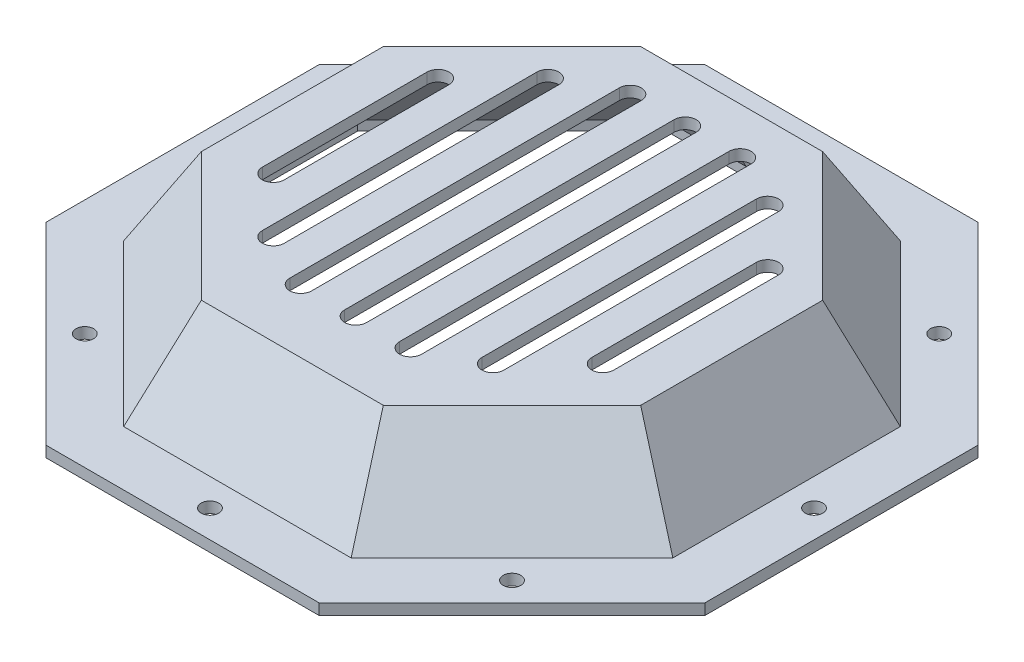
from build123d import *

# Parameters (mm, degrees)
SKETCH1_R           = 1.6
BOSS_EXTRUDE1_DEPTH = 3
CUT_EXTRUDE1_DEPTH  = 85.905830189
BOSS_EXTRUDE2_DEPTH = 2
BOSS_EXTRUDE3_DEPTH = 3
SHELL1_DEPTH        = 15
SHELL1_DRAFT        = 30.4655449
SKETCH6_W           = 10
SKETCH6_H           = 10
CUT_EXTRUDE2_DEPTH  = 88.177978871
CUT_EXTRUDE3_DEPTH  = 88.177978894
SKETCH8_W           = 151.222151061
SKETCH8_H           = 131.165318394
CUT_EXTRUDE4_DEPTH  = 1


# Read off the part's stored shape, not the designer's step: Shell1
with BuildPart() as part:
    # Sketch1 → Boss-Extrude1 (new body)
    with BuildSketch(Plane(origin=(0, 0, 0), x_dir=(1, 0, 0), z_dir=(0, 1, 0))):
        Polygon((24.852813742, 60), (-24.852813742, 60), (-60, 24.852813742), (-60, -24.852813742), (-24.852813742, -60), (24.852813742, -60), (60, -24.852813742), (60, 24.852813742), align=None)
        with Locations(Location((-38.890872965, -38.890872965, 0), (0, 0, 270))):
            Circle(SKETCH1_R, mode=Mode.SUBTRACT)
        with Locations(Location((0, -55, 0), (0, 0, 270))):
            Circle(SKETCH1_R, mode=Mode.SUBTRACT)
        with Locations(Location((38.890872965, -38.890872965, 0), (0, 0, 270))):
            Circle(SKETCH1_R, mode=Mode.SUBTRACT)
        with Locations(Location((38.890872965, 38.890872965, 0), (0, 0, 270))):
            Circle(SKETCH1_R, mode=Mode.SUBTRACT)
        with Locations(Location((0, 55, 0), (0, 0, 270))):
            Circle(SKETCH1_R, mode=Mode.SUBTRACT)
        with Locations(Location((-38.890872965, 38.890872965, 0), (0, 0, 270))):
            Circle(SKETCH1_R, mode=Mode.SUBTRACT)
        with Locations(Location((55, 0, 0), (0, 0, 270))):
            Circle(SKETCH1_R, mode=Mode.SUBTRACT)
        with Locations(Location((-55, 0, 0), (0, 0, 270))):
            Circle(SKETCH1_R, mode=Mode.SUBTRACT)
    extrude(amount=BOSS_EXTRUDE1_DEPTH)

    # Sketch2 → Cut-Extrude1 (cut, through all)
    with BuildSketch(Plane(origin=(0, 3, 0), x_dir=(1, 0, 0), z_dir=(0, 1, 0))):
        Polygon((20.710678119, 50), (-20.710678119, 50), (-50, 20.710678119), (-50, -20.710678119), (-20.710678119, -50), (20.710678119, -50), (50, -20.710678119), (50, 20.710678119), align=None)
    extrude(amount=-CUT_EXTRUDE1_DEPTH, mode=Mode.SUBTRACT)



with BuildPart() as body_2:
    # Sketch3 → Boss-Extrude2 (new body)
    with BuildSketch(Plane(origin=(0, 18, 0), x_dir=(1, 0, 0), z_dir=(0, 1, 0))):
        Polygon((16.568542495, 40), (-16.568542495, 40), (-40, 16.568542495), (-40, -16.568542495), (-16.568542495, -40), (16.568542495, -40), (40, -16.568542495), (40, 16.568542495), align=None)
    extrude(amount=BOSS_EXTRUDE2_DEPTH)

    # Sketch2<2> → section 0 of loft1
    with BuildSketch(Plane(origin=(0, 3, 0), x_dir=(1, 0, 0), z_dir=(0, 1, 0)), mode=Mode.PRIVATE) as loft1_s0:
        with BuildLine():
            Line((20.710678119, 50), (-20.710678119, 50))
            Line((-20.710678119, 50), (-50, 20.710678119))
            Line((-50, 20.710678119), (-50, -20.710678119))
            Line((-50, -20.710678119), (-20.710678119, -50))
            Line((-20.710678119, -50), (20.710678119, -50))
            Line((20.710678119, -50), (50, -20.710678119))
            Line((50, -20.710678119), (50, 20.710678119))
            Line((50, 20.710678119), (20.710678119, 50))
        make_face()
    # loft up to a face of the part (loft1)
    loft([loft1_s0.sketch, body_2.faces().sort_by_distance((0, 20, 0))[0]])


with BuildPart() as part_1:
    add(part.part)

    add(body_2.part)  # Boss-Extrude3 merges body 2
    # Sketch5 → Boss-Extrude3 (add)
    with BuildSketch(Plane.XZ.offset(-3)):
        Polygon((-50, -20.710678119), (-20.710678119, -50), (20.710678119, -50), (50, -20.710678119), (50, 20.710678119), (20.710678119, 50), (-20.710678119, 50), (-50, 20.710678119), align=None)
        Polygon((48, -19.882250994), (19.882250994, -48), (-19.882250994, -48), (-48, -19.882250994), (-48, 19.882250994), (-19.882250994, 48), (19.882250994, 48), (48, 19.882250994), align=None, mode=Mode.SUBTRACT)
    extrude(amount=BOSS_EXTRUDE3_DEPTH)


with BuildPart() as shell1_tool:
    # Shell1 outline → Shell1 (with draft: the straight prism first)
    with BuildSketch(Plane(origin=(0, 18, 0), x_dir=(1, 0, 0), z_dir=(0, 1, 0))):
        Polygon((16.09472687, 38.856107891), (-16.09472687, 38.856107891), (-38.856107891, 16.09472687), (-38.856107891, -16.09472687), (-16.09472687, -38.856107891), (16.09472687, -38.856107891), (38.856107891, -16.09472687), (38.856107891, 16.09472687), align=None)
    extrude(amount=-SHELL1_DEPTH)
    # Shell1: the draft: its side faces are tilted about the plane it starts from
    shell1_sides = [shell1_tool.faces().sort_by_distance(p)[0] for p in [
        (0, 10.5, -38.856107891),
        (-27.475417381, 10.5, -27.47541738),
        (-38.856107891, 10.5, 0),
        (-27.47541738, 10.5, 27.475417381),
        (0, 10.5, 38.856107891),
        (27.475417381, 10.5, 27.47541738),
        (38.856107891, 10.5, 0),
        (27.47541738, 10.5, -27.475417381),
    ]]
    draft(shell1_sides, Plane(origin=(0, 18, 0), x_dir=(1, 0, 0), z_dir=(0, 1, 0)), SHELL1_DRAFT)


with BuildPart() as part_2:
    add(part_1.part)

    # Shell1: cut by shell1_tool
    add(shell1_tool.part, mode=Mode.SUBTRACT)

    # Sketch6 → Cut-Extrude2 (cut, through all)
    with BuildSketch(Plane(origin=(0, 20, 0), x_dir=(1, 0, 0), z_dir=(0, 1, 0))):
        with Locations((0, 45)):
            Rectangle(SKETCH6_W, SKETCH6_H)
    extrude(amount=-CUT_EXTRUDE2_DEPTH, mode=Mode.SUBTRACT)

    # Sketch7 → Cut-Extrude3 (cut, through all)
    with BuildSketch(Plane(origin=(0, 20, 0), x_dir=(1, 0, 0), z_dir=(0, 1, 0))):
        with BuildLine():
            Line((-22, 26.533930893), (-22, -23.466069107))
            ThreePointArc((-22, -23.466069107), (-20, -25.466069107), (-18, -23.466069107))
            Line((-18, -23.466069107), (-18, 26.533930893))
            ThreePointArc((-18, 26.533930893), (-20, 28.533930893), (-22, 26.533930893))
        make_face()
        with BuildLine():
            Line((-28, 16.533930893), (-28, -13.466069107))
            ThreePointArc((-28, -13.466069107), (-30, -15.466069107), (-32, -13.466069107))
            Line((-32, -13.466069107), (-32, 16.533930893))
            ThreePointArc((-32, 16.533930893), (-30, 18.533930893), (-28, 16.533930893))
        make_face()
        with BuildLine():
            Line((-8, 31.533930893), (-8, -28.466069107))
            ThreePointArc((-8, -28.466069107), (-10, -30.466069107), (-12, -28.466069107))
            Line((-12, -28.466069107), (-12, 31.533930893))
            ThreePointArc((-12, 31.533930893), (-10, 33.533930893), (-8, 31.533930893))
        make_face()
        with BuildLine():
            Line((2, 31.533930893), (2, -28.466069107))
            ThreePointArc((2, -28.466069107), (0, -30.466069107), (-2, -28.466069107))
            Line((-2, -28.466069107), (-2, 31.533930893))
            ThreePointArc((-2, 31.533930893), (0, 33.533930893), (2, 31.533930893))
        make_face()
    cut_extrude3 = extrude(amount=-CUT_EXTRUDE3_DEPTH, mode=Mode.SUBTRACT)

    # Mirror1: Cut-Extrude3 across plane
    add(cut_extrude3.mirror(Plane.ZY), mode=Mode.SUBTRACT)

    # Sketch8 → Cut-Extrude4 (cut)
    with BuildSketch(Plane.XZ):
        with Locations((-0.059380878, -1.432630905)):
            Rectangle(SKETCH8_W, SKETCH8_H)
    extrude(amount=-CUT_EXTRUDE4_DEPTH, mode=Mode.SUBTRACT)


solid = part_2.part
